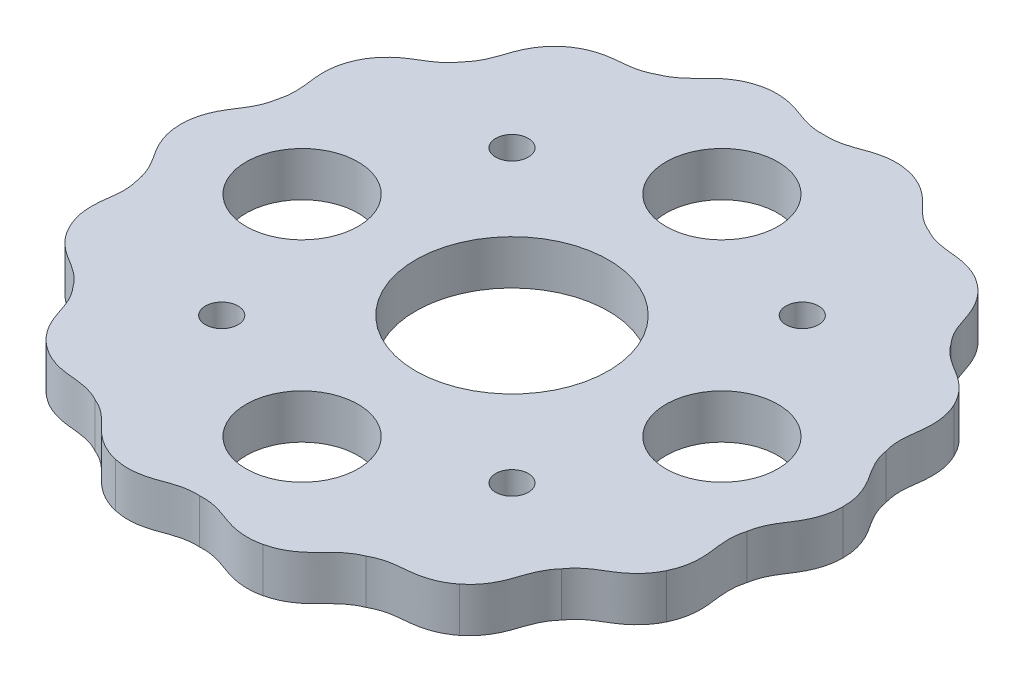
from build123d import *

# Parameters (mm, degrees)
BOSS_EXTRUDE3_DEPTH = 4.7625
SKETCH2_R           = 10.328125
SKETCH2_R_2         = 6
CUT_EXTRUDE1_DEPTH  = 4.7625
SKETCH2_4_R         = 1.75
CUT_EXTRUDE2_DEPTH  = 2.625


with BuildPart() as part:
    # Sketch1 → Boss-Extrude3 (new body)
    with BuildSketch(Plane(origin=(0, 0, 0), x_dir=(1, 0, 0), z_dir=(0, 1, 0))):
        with BuildLine():
            Line((35.500002326, 0.003735881), (35.500002326, 0))
            Line((35.500002326, 0), (35.500002326, -0.003735881))
            add(Edge.make_bspline(
                [(32.644810899, -7.45096506), (32.674793712, -7.260710929), (32.757965618, -6.873262555), (32.975088878, -6.197475635), (33.30681421, -5.487322542), (33.693887271, -4.83935734), (34.139372051, -4.165162167), (34.499748971, -3.6014921), (34.870711868, -2.889611748), (35.149566879, -2.192738575), (35.418263863, -1.23361479), (35.50061524, -0.495919336), (35.500002326, -0.003735881)],
                knots=[0.02301065, 0.02301065, 0.02301065, 0.02301065, 0.053541567, 0.084072485, 0.145134319, 0.206196153, 0.267257988, 0.389381656, 0.511505325, 0.633628994, 0.755752663, 1, 1, 1, 1], degree=3))
            add(Edge.make_bspline(
                [(31.986017844, -15.399507835), (32.200120458, -14.956331799), (32.445998494, -14.255960238), (32.62005909, -13.275236314), (32.671181344, -12.526384626), (32.645828632, -11.724047822), (32.565707523, -11.059836954), (32.456861927, -10.25911949), (32.389262714, -9.507378309), (32.398512397, -8.723622254), (32.496104055, -8.020553026), (32.589276306, -7.635387164), (32.644810899, -7.45096506)],
                knots=[0.02301065, 0.02301065, 0.02301065, 0.02301065, 0.267257988, 0.389381656, 0.511505325, 0.633628994, 0.755752663, 0.816814497, 0.877876331, 0.938938166, 0.969469083, 1, 1, 1, 1], degree=3))
            Line((31.986017844, -15.399507835), (31.984396906, -15.402873748))
            Line((31.984396906, -15.402873748), (31.982775968, -15.406239661))
            add(Edge.make_bspline(
                [(26.179105738, -20.877140171), (26.288667493, -20.718736177), (26.531710341, -20.405744191), (27.020544594, -19.891087467), (27.62754267, -19.395191866), (28.257425012, -18.979340099), (28.951315253, -18.565199839), (29.520570914, -18.213712342), (30.163670245, -17.733285076), (30.717271866, -17.226414698), (31.375507699, -16.478857279), (31.769777787, -15.849947564), (31.982775968, -15.406239661)],
                knots=[0.02301065, 0.02301065, 0.02301065, 0.02301065, 0.053541567, 0.084072485, 0.145134319, 0.206196153, 0.267257988, 0.389381656, 0.511505325, 0.633628994, 0.755752663, 1, 1, 1, 1], degree=3))
            add(Edge.make_bspline(
                [(22.136810246, -27.752690162), (22.521996911, -27.446297993), (23.047405198, -26.921967502), (23.62974854, -26.113887841), (24.00072267, -25.461376898), (24.326001557, -24.727496287), (24.542005228, -24.094299727), (24.791357022, -23.325651886), (25.05662051, -22.619026286), (25.405013194, -21.916899767), (25.797990545, -21.325799714), (26.049053047, -21.019203188), (26.179105738, -20.877140171)],
                knots=[0.02301065, 0.02301065, 0.02301065, 0.02301065, 0.267257988, 0.389381656, 0.511505325, 0.633628994, 0.755752663, 0.816814497, 0.877876331, 0.938938166, 0.969469083, 1, 1, 1, 1], degree=3))
            Line((22.136810246, -27.752690162), (22.133889416, -27.755019446))
            Line((22.133889416, -27.755019446), (22.130968587, -27.75734873))
            add(Edge.make_bspline(
                [(14.52830762, -30.168341629), (14.695748267, -30.073161626), (15.05052444, -29.89661793), (15.714250068, -29.645025478), (16.476297475, -29.461605575), (17.224233175, -29.360231784), (18.029095404, -29.288171996), (18.694481743, -29.218483478), (19.482343797, -29.064663811), (20.201044438, -28.848188121), (21.118447439, -28.460259983), (21.746546212, -28.06469929), (22.130968587, -27.75734873)],
                knots=[0.02301065, 0.02301065, 0.02301065, 0.02301065, 0.053541567, 0.084072485, 0.145134319, 0.206196153, 0.267257988, 0.389381656, 0.511505325, 0.633628994, 0.755752663, 1, 1, 1, 1], degree=3))
            add(Edge.make_bspline(
                [(7.903135888, -34.609111839), (8.383115662, -34.500188263), (9.083990645, -34.255748926), (9.959276491, -33.780363616), (10.576626521, -33.353431213), (11.188111536, -32.833360849), (11.657457809, -32.356590942), (12.215619812, -31.772252855), (12.761207314, -31.250698702), (13.379739556, -30.769266488), (13.990268616, -30.407210225), (14.349495361, -30.239908237), (14.52830762, -30.168341629)],
                knots=[0.02301065, 0.02301065, 0.02301065, 0.02301065, 0.267257988, 0.389381656, 0.511505325, 0.633628994, 0.755752663, 0.816814497, 0.877876331, 0.938938166, 0.969469083, 1, 1, 1, 1], degree=3))
            Line((7.903135888, -34.609111839), (7.899493673, -34.60994315))
            Line((7.899493673, -34.60994315), (7.895851458, -34.610774462))
            add(Edge.make_bspline(
                [(0, -33.484333037), (0.192155866, -33.471228592), (0.588397592, -33.466099831), (1.295555593, -33.527402621), (2.061719496, -33.692786976), (2.779570716, -33.925969485), (3.535992098, -34.210262493), (4.165721189, -34.43617562), (4.942300224, -34.639429423), (5.683752409, -34.756224087), (6.678619663, -34.804759157), (7.416144457, -34.72089313), (7.895851458, -34.610774462)],
                knots=[0.02301065, 0.02301065, 0.02301065, 0.02301065, 0.053541567, 0.084072485, 0.145134319, 0.206196153, 0.267257988, 0.389381656, 0.511505325, 0.633628994, 0.755752663, 1, 1, 1, 1], degree=3))
            add(Edge.make_bspline(
                [(-7.895851458, -34.610774462), (-7.416144457, -34.72089313), (-6.678619663, -34.804759157), (-5.683752409, -34.756224087), (-4.942300224, -34.639429423), (-4.165721189, -34.43617562), (-3.535992098, -34.210262493), (-2.779570716, -33.925969485), (-2.061719496, -33.692786976), (-1.295555593, -33.527402621), (-0.588397592, -33.466099831), (-0.192155866, -33.471228592), (0, -33.484333037)],
                knots=[0.02301065, 0.02301065, 0.02301065, 0.02301065, 0.267257988, 0.389381656, 0.511505325, 0.633628994, 0.755752663, 0.816814497, 0.877876331, 0.938938166, 0.969469083, 1, 1, 1, 1], degree=3))
            Line((-7.895851458, -34.610774462), (-7.899493673, -34.60994315))
            Line((-7.899493673, -34.60994315), (-7.903135888, -34.609111839))
            add(Edge.make_bspline(
                [(-14.52830762, -30.168341629), (-14.349495361, -30.239908237), (-13.990268616, -30.407210225), (-13.379739556, -30.769266488), (-12.761207314, -31.250698702), (-12.215619812, -31.772252855), (-11.657457809, -32.356590942), (-11.188111536, -32.833360849), (-10.576626521, -33.353431213), (-9.959276491, -33.780363616), (-9.083990645, -34.255748926), (-8.383115662, -34.500188263), (-7.903135888, -34.609111839)],
                knots=[0.02301065, 0.02301065, 0.02301065, 0.02301065, 0.053541567, 0.084072485, 0.145134319, 0.206196153, 0.267257988, 0.389381656, 0.511505325, 0.633628994, 0.755752663, 1, 1, 1, 1], degree=3))
            add(Edge.make_bspline(
                [(-22.130968587, -27.75734873), (-21.746546212, -28.06469929), (-21.118447439, -28.460259983), (-20.201044438, -28.848188121), (-19.482343797, -29.064663811), (-18.694481743, -29.218483478), (-18.029095404, -29.288171996), (-17.224233175, -29.360231784), (-16.476297475, -29.461605575), (-15.714250068, -29.645025478), (-15.05052444, -29.89661793), (-14.695748267, -30.073161626), (-14.52830762, -30.168341629)],
                knots=[0.02301065, 0.02301065, 0.02301065, 0.02301065, 0.267257988, 0.389381656, 0.511505325, 0.633628994, 0.755752663, 0.816814497, 0.877876331, 0.938938166, 0.969469083, 1, 1, 1, 1], degree=3))
            Line((-22.130968587, -27.75734873), (-22.133889416, -27.755019446))
            Line((-22.133889416, -27.755019446), (-22.136810246, -27.752690162))
            add(Edge.make_bspline(
                [(-26.179105738, -20.877140171), (-26.049053047, -21.019203188), (-25.797990545, -21.325799714), (-25.405013194, -21.916899767), (-25.05662051, -22.619026286), (-24.791357022, -23.325651886), (-24.542005228, -24.094299727), (-24.326001557, -24.727496287), (-24.00072267, -25.461376898), (-23.62974854, -26.113887841), (-23.047405198, -26.921967502), (-22.521996911, -27.446297993), (-22.136810246, -27.752690162)],
                knots=[0.02301065, 0.02301065, 0.02301065, 0.02301065, 0.053541567, 0.084072485, 0.145134319, 0.206196153, 0.267257988, 0.389381656, 0.511505325, 0.633628994, 0.755752663, 1, 1, 1, 1], degree=3))
            add(Edge.make_bspline(
                [(-31.982775968, -15.406239661), (-31.769777787, -15.849947564), (-31.375507698, -16.478857279), (-30.717271866, -17.226414698), (-30.163670245, -17.733285076), (-29.520570914, -18.213712342), (-28.951315253, -18.565199839), (-28.257425012, -18.979340099), (-27.62754267, -19.395191866), (-27.020544594, -19.891087467), (-26.531710341, -20.405744191), (-26.288667493, -20.718736177), (-26.179105738, -20.877140171)],
                knots=[0.02301065, 0.02301065, 0.02301065, 0.02301065, 0.267257988, 0.389381656, 0.511505325, 0.633628994, 0.755752663, 0.816814497, 0.877876331, 0.938938166, 0.969469083, 1, 1, 1, 1], degree=3))
            Line((-31.982775968, -15.406239661), (-31.984396906, -15.402873748))
            Line((-31.984396906, -15.402873748), (-31.986017844, -15.399507835))
            add(Edge.make_bspline(
                [(-32.644810899, -7.45096506), (-32.589276306, -7.635387164), (-32.496104055, -8.020553026), (-32.398512397, -8.723622254), (-32.389262714, -9.507378309), (-32.456861927, -10.25911949), (-32.565707523, -11.059836954), (-32.645828632, -11.724047822), (-32.671181344, -12.526384626), (-32.62005909, -13.275236314), (-32.445998494, -14.255960238), (-32.200120458, -14.956331799), (-31.986017844, -15.399507835)],
                knots=[0.02301065, 0.02301065, 0.02301065, 0.02301065, 0.053541567, 0.084072485, 0.145134319, 0.206196153, 0.267257988, 0.389381656, 0.511505325, 0.633628994, 0.755752663, 1, 1, 1, 1], degree=3))
            add(Edge.make_bspline(
                [(-35.500002326, -0.003735881), (-35.50061524, -0.495919336), (-35.418263863, -1.23361479), (-35.149566879, -2.192738575), (-34.870711868, -2.889611748), (-34.499748971, -3.6014921), (-34.139372051, -4.165162167), (-33.693887271, -4.83935734), (-33.30681421, -5.487322542), (-32.975088878, -6.197475635), (-32.757965618, -6.873262555), (-32.674793712, -7.260710929), (-32.644810899, -7.45096506)],
                knots=[0.02301065, 0.02301065, 0.02301065, 0.02301065, 0.267257988, 0.389381656, 0.511505325, 0.633628994, 0.755752663, 0.816814497, 0.877876331, 0.938938166, 0.969469083, 1, 1, 1, 1], degree=3))
            Line((-35.500002326, -0.003735881), (-35.500002326, 0))
            Line((-35.500002326, 0), (-35.500002326, 0.003735881))
            add(Edge.make_bspline(
                [(-32.644810899, 7.45096506), (-32.674793712, 7.260710929), (-32.757965618, 6.873262555), (-32.975088878, 6.197475635), (-33.30681421, 5.487322542), (-33.693887271, 4.83935734), (-34.139372051, 4.165162167), (-34.499748971, 3.6014921), (-34.870711868, 2.889611748), (-35.149566879, 2.192738575), (-35.418263863, 1.23361479), (-35.50061524, 0.495919336), (-35.500002326, 0.003735881)],
                knots=[0.02301065, 0.02301065, 0.02301065, 0.02301065, 0.053541567, 0.084072485, 0.145134319, 0.206196153, 0.267257988, 0.389381656, 0.511505325, 0.633628994, 0.755752663, 1, 1, 1, 1], degree=3))
            add(Edge.make_bspline(
                [(-31.986017844, 15.399507835), (-32.200120458, 14.956331799), (-32.445998494, 14.255960238), (-32.62005909, 13.275236314), (-32.671181344, 12.526384626), (-32.645828632, 11.724047822), (-32.565707523, 11.059836954), (-32.456861927, 10.25911949), (-32.389262714, 9.507378309), (-32.398512397, 8.723622254), (-32.496104055, 8.020553026), (-32.589276306, 7.635387164), (-32.644810899, 7.45096506)],
                knots=[0.02301065, 0.02301065, 0.02301065, 0.02301065, 0.267257988, 0.389381656, 0.511505325, 0.633628994, 0.755752663, 0.816814497, 0.877876331, 0.938938166, 0.969469083, 1, 1, 1, 1], degree=3))
            Line((-31.986017844, 15.399507835), (-31.984396906, 15.402873748))
            Line((-31.984396906, 15.402873748), (-31.982775968, 15.406239661))
            add(Edge.make_bspline(
                [(-26.179105738, 20.877140171), (-26.288667493, 20.718736177), (-26.531710341, 20.405744191), (-27.020544594, 19.891087467), (-27.62754267, 19.395191866), (-28.257425012, 18.979340099), (-28.951315253, 18.565199839), (-29.520570914, 18.213712342), (-30.163670245, 17.733285076), (-30.717271866, 17.226414698), (-31.375507699, 16.478857278), (-31.769777787, 15.849947564), (-31.982775968, 15.406239661)],
                knots=[0.02301065, 0.02301065, 0.02301065, 0.02301065, 0.053541567, 0.084072485, 0.145134319, 0.206196153, 0.267257988, 0.389381656, 0.511505325, 0.633628994, 0.755752663, 1, 1, 1, 1], degree=3))
            add(Edge.make_bspline(
                [(-22.136810246, 27.752690162), (-22.521996911, 27.446297993), (-23.047405198, 26.921967502), (-23.62974854, 26.113887841), (-24.00072267, 25.461376898), (-24.326001557, 24.727496287), (-24.542005228, 24.094299727), (-24.791357022, 23.325651886), (-25.05662051, 22.619026286), (-25.405013194, 21.916899767), (-25.797990545, 21.325799714), (-26.049053047, 21.019203188), (-26.179105738, 20.877140171)],
                knots=[0.02301065, 0.02301065, 0.02301065, 0.02301065, 0.267257988, 0.389381656, 0.511505325, 0.633628994, 0.755752663, 0.816814497, 0.877876331, 0.938938166, 0.969469083, 1, 1, 1, 1], degree=3))
            Line((-22.136810246, 27.752690162), (-22.133889416, 27.755019446))
            Line((-22.133889416, 27.755019446), (-22.130968587, 27.75734873))
            add(Edge.make_bspline(
                [(-14.52830762, 30.168341629), (-14.695748267, 30.073161626), (-15.05052444, 29.89661793), (-15.714250068, 29.645025478), (-16.476297475, 29.461605575), (-17.224233175, 29.360231784), (-18.029095404, 29.288171996), (-18.694481743, 29.218483478), (-19.482343797, 29.064663811), (-20.201044438, 28.848188121), (-21.118447439, 28.460259983), (-21.746546212, 28.06469929), (-22.130968587, 27.75734873)],
                knots=[0.02301065, 0.02301065, 0.02301065, 0.02301065, 0.053541567, 0.084072485, 0.145134319, 0.206196153, 0.267257988, 0.389381656, 0.511505325, 0.633628994, 0.755752663, 1, 1, 1, 1], degree=3))
            add(Edge.make_bspline(
                [(-7.903135888, 34.609111839), (-8.383115662, 34.500188263), (-9.083990645, 34.255748926), (-9.959276491, 33.780363616), (-10.576626521, 33.353431213), (-11.188111536, 32.833360849), (-11.657457809, 32.356590942), (-12.215619812, 31.772252855), (-12.761207314, 31.250698702), (-13.379739556, 30.769266488), (-13.990268616, 30.407210225), (-14.349495361, 30.239908237), (-14.52830762, 30.168341629)],
                knots=[0.02301065, 0.02301065, 0.02301065, 0.02301065, 0.267257988, 0.389381656, 0.511505325, 0.633628994, 0.755752663, 0.816814497, 0.877876331, 0.938938166, 0.969469083, 1, 1, 1, 1], degree=3))
            Line((-7.903135888, 34.609111839), (-7.899493673, 34.60994315))
            Line((-7.899493673, 34.60994315), (-7.895851458, 34.610774462))
            add(Edge.make_bspline(
                [(0, 33.484333037), (-0.192155866, 33.471228592), (-0.588397592, 33.466099831), (-1.295555593, 33.527402621), (-2.061719496, 33.692786976), (-2.779570716, 33.925969485), (-3.535992098, 34.210262493), (-4.165721189, 34.43617562), (-4.942300224, 34.639429423), (-5.683752409, 34.756224087), (-6.678619663, 34.804759157), (-7.416144457, 34.72089313), (-7.895851458, 34.610774462)],
                knots=[0.02301065, 0.02301065, 0.02301065, 0.02301065, 0.053541567, 0.084072485, 0.145134319, 0.206196153, 0.267257988, 0.389381656, 0.511505325, 0.633628994, 0.755752663, 1, 1, 1, 1], degree=3))
            add(Edge.make_bspline(
                [(7.895851458, 34.610774462), (7.416144457, 34.72089313), (6.678619663, 34.804759157), (5.683752409, 34.756224087), (4.942300224, 34.639429423), (4.165721189, 34.43617562), (3.535992098, 34.210262493), (2.779570716, 33.925969485), (2.061719496, 33.692786976), (1.295555593, 33.527402621), (0.588397592, 33.466099831), (0.192155866, 33.471228592), (0, 33.484333037)],
                knots=[0.02301065, 0.02301065, 0.02301065, 0.02301065, 0.267257988, 0.389381656, 0.511505325, 0.633628994, 0.755752663, 0.816814497, 0.877876331, 0.938938166, 0.969469083, 1, 1, 1, 1], degree=3))
            Line((7.895851458, 34.610774462), (7.899493673, 34.60994315))
            Line((7.899493673, 34.60994315), (7.903135888, 34.609111839))
            add(Edge.make_bspline(
                [(14.52830762, 30.168341629), (14.349495361, 30.239908237), (13.990268616, 30.407210225), (13.379739556, 30.769266488), (12.761207314, 31.250698702), (12.215619812, 31.772252855), (11.657457809, 32.356590942), (11.188111536, 32.833360849), (10.576626521, 33.353431213), (9.959276491, 33.780363616), (9.083990645, 34.255748926), (8.383115662, 34.500188263), (7.903135888, 34.609111839)],
                knots=[0.02301065, 0.02301065, 0.02301065, 0.02301065, 0.053541567, 0.084072485, 0.145134319, 0.206196153, 0.267257988, 0.389381656, 0.511505325, 0.633628994, 0.755752663, 1, 1, 1, 1], degree=3))
            add(Edge.make_bspline(
                [(22.130968587, 27.75734873), (21.746546212, 28.06469929), (21.118447439, 28.460259983), (20.201044438, 28.848188121), (19.482343797, 29.064663811), (18.694481743, 29.218483478), (18.029095404, 29.288171996), (17.224233175, 29.360231784), (16.476297475, 29.461605575), (15.714250068, 29.645025478), (15.05052444, 29.89661793), (14.695748267, 30.073161626), (14.52830762, 30.168341629)],
                knots=[0.02301065, 0.02301065, 0.02301065, 0.02301065, 0.267257988, 0.389381656, 0.511505325, 0.633628994, 0.755752663, 0.816814497, 0.877876331, 0.938938166, 0.969469083, 1, 1, 1, 1], degree=3))
            Line((22.130968587, 27.75734873), (22.133889416, 27.755019446))
            Line((22.133889416, 27.755019446), (22.136810246, 27.752690162))
            add(Edge.make_bspline(
                [(26.179105738, 20.877140171), (26.049053047, 21.019203188), (25.797990545, 21.325799714), (25.405013194, 21.916899767), (25.05662051, 22.619026286), (24.791357022, 23.325651886), (24.542005228, 24.094299727), (24.326001557, 24.727496287), (24.00072267, 25.461376898), (23.62974854, 26.113887841), (23.047405198, 26.921967502), (22.521996911, 27.446297993), (22.136810246, 27.752690162)],
                knots=[0.02301065, 0.02301065, 0.02301065, 0.02301065, 0.053541567, 0.084072485, 0.145134319, 0.206196153, 0.267257988, 0.389381656, 0.511505325, 0.633628994, 0.755752663, 1, 1, 1, 1], degree=3))
            add(Edge.make_bspline(
                [(31.982775968, 15.406239661), (31.769777787, 15.849947564), (31.375507698, 16.478857279), (30.717271866, 17.226414698), (30.163670245, 17.733285076), (29.520570914, 18.213712342), (28.951315253, 18.565199839), (28.257425012, 18.979340099), (27.62754267, 19.395191866), (27.020544594, 19.891087467), (26.531710341, 20.405744191), (26.288667493, 20.718736177), (26.179105738, 20.877140171)],
                knots=[0.02301065, 0.02301065, 0.02301065, 0.02301065, 0.267257988, 0.389381656, 0.511505325, 0.633628994, 0.755752663, 0.816814497, 0.877876331, 0.938938166, 0.969469083, 1, 1, 1, 1], degree=3))
            Line((31.982775968, 15.406239661), (31.984396906, 15.402873748))
            Line((31.984396906, 15.402873748), (31.986017844, 15.399507835))
            add(Edge.make_bspline(
                [(32.644810899, 7.45096506), (32.589276306, 7.635387164), (32.496104055, 8.020553026), (32.398512397, 8.723622254), (32.389262714, 9.507378309), (32.456861927, 10.25911949), (32.565707523, 11.059836954), (32.645828632, 11.724047822), (32.671181344, 12.526384626), (32.62005909, 13.275236314), (32.445998494, 14.255960238), (32.200120458, 14.956331799), (31.986017844, 15.399507835)],
                knots=[0.02301065, 0.02301065, 0.02301065, 0.02301065, 0.053541567, 0.084072485, 0.145134319, 0.206196153, 0.267257988, 0.389381656, 0.511505325, 0.633628994, 0.755752663, 1, 1, 1, 1], degree=3))
            add(Edge.make_bspline(
                [(35.500002326, 0.003735881), (35.50061524, 0.495919336), (35.418263863, 1.23361479), (35.149566879, 2.192738575), (34.870711868, 2.889611748), (34.499748971, 3.6014921), (34.139372051, 4.165162167), (33.693887271, 4.83935734), (33.30681421, 5.487322542), (32.975088878, 6.197475635), (32.757965618, 6.873262555), (32.674793712, 7.260710929), (32.644810899, 7.45096506)],
                knots=[0.02301065, 0.02301065, 0.02301065, 0.02301065, 0.267257988, 0.389381656, 0.511505325, 0.633628994, 0.755752663, 0.816814497, 0.877876331, 0.938938166, 0.969469083, 1, 1, 1, 1], degree=3))
        make_face()
    extrude(amount=BOSS_EXTRUDE3_DEPTH)

    # Sketch2 → Cut-Extrude1 (cut)
    with BuildSketch(Plane(origin=(0, 4.7625, 0), x_dir=(1, 0, 0), z_dir=(0, 1, 0))):
        Circle(SKETCH2_R)
        with Locations((22.5, 0)):
            Circle(SKETCH2_R_2)
        with Locations((0, -22.5)):
            Circle(SKETCH2_R_2)
        with Locations((-22.5, 0)):
            Circle(SKETCH2_R_2)
        with Locations((0, 22.5)):
            Circle(SKETCH2_R_2)
    extrude(amount=-CUT_EXTRUDE1_DEPTH, mode=Mode.SUBTRACT)

    # Sketch2<4> → Cut-Extrude2 (cut)
    with BuildSketch(Plane(origin=(0, 4.7625, 0), x_dir=(1, 0, 0), z_dir=(0, 1, 0))):
        with Locations((15.556349186, 15.556349186)):
            Circle(SKETCH2_4_R)
        with Locations((15.556349186, -15.556349186)):
            Circle(SKETCH2_4_R)
        with Locations((-15.556349186, -15.556349186)):
            Circle(SKETCH2_4_R)
        with Locations((-15.556349186, 15.556349186)):
            Circle(SKETCH2_4_R)
    extrude(amount=-CUT_EXTRUDE2_DEPTH, mode=Mode.SUBTRACT)


solid = part.part
